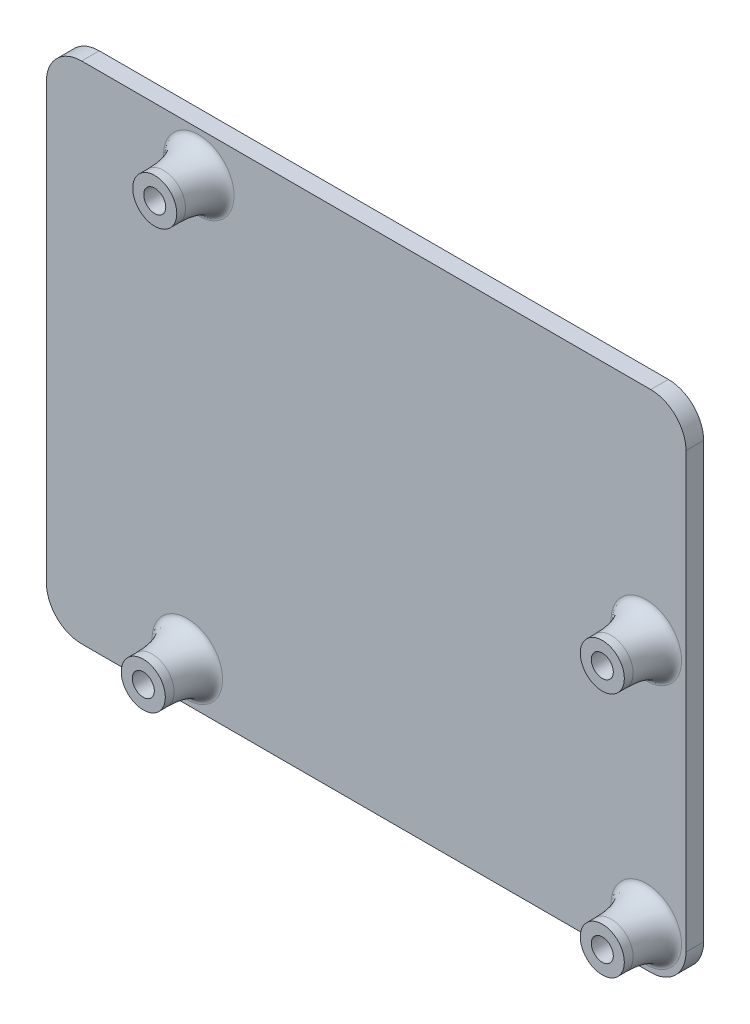
from build123d import *

# Parameters (mm, degrees)
SKETCH1_W           = 68.6
SKETCH1_H           = 53.3
BOSS_EXTRUDE1_DEPTH = 2
SKETCH6_W           = 72.6
SKETCH6_H           = 57.3
BOSS_EXTRUDE3_DEPTH = 2
SKETCH3_R           = 2.5
BOSS_EXTRUDE2_DEPTH = 5
FILLET1_SIZE        = 1.5
FILLET1_SIZE_2      = 4
FILLET2_R           = 4


with BuildPart() as part:
    # Sketch1 → Boss-Extrude1 (new body)
    with BuildSketch(Plane.XY):
        with Locations((16.907139599, -0.839393248)):
            Rectangle(SKETCH1_W, SKETCH1_H)
    extrude(amount=BOSS_EXTRUDE1_DEPTH)

    # Sketch6 → Boss-Extrude3 (add)
    with BuildSketch(Plane.XY.offset(2)):
        with Locations((16.907139599, -0.839393248)):
            Rectangle(SKETCH6_W, SKETCH6_H)
    extrude(amount=-BOSS_EXTRUDE3_DEPTH)

    # Sketch3 → Boss-Extrude2 (add)
    with BuildSketch(Plane.XY.offset(2)):
        with Locations((-2.092860401, 23.210606752)):
            Circle(SKETCH3_R)
    boss_extrude2 = extrude(amount=BOSS_EXTRUDE2_DEPTH)

    # Sketch5 → Tap Drill for M3x0.5 Tap1 (revolve, cut)
    with BuildSketch(Plane(origin=(-2.092860401, 23.210606752, 7), x_dir=(0, -1, 0), z_dir=(1, 0, 0))):
        Polygon((0, 0), (0, 10.751075774), (1.25, 10), (1.25, 0), align=None)
    tap_drill_for_m3x0_5_tap1 = revolve(axis=Axis((-2.092860401, 23.210606752, 13.35), (0, 0, -1)), mode=Mode.SUBTRACT)

    # Sketch-Pattern1: Boss-Extrude2, Tap Drill for M3x0.5 Tap1 at 3 more places
    with Locations((50.8, -48.2, 0), (-1.3, -48.2, 0), (50.8, -20.3, 0)):
        add(boss_extrude2)
        add(tap_drill_for_m3x0_5_tap1, mode=Mode.SUBTRACT)

    # Fillet1
    # an asymmetric fillet: 4, 1.5 mm, written as the material it adds along each edge
    with BuildSketch(Plane(origin=(-2.092860401, 23.210606752, 2), x_dir=(1, 0, 0), z_dir=(0, -1, 0))) as fillet1_piece_1:
        with BuildLine():
            Bezier((2.5 + FILLET1_SIZE, 0), (2.5, 0), (2.5, FILLET1_SIZE_2), weights=[1, 0.707106781, 1])
            Line((2.5, FILLET1_SIZE_2), (2.5, 0))
            Line((2.5, 0), (2.5 + FILLET1_SIZE, 0))
        make_face()
    revolve(axis=Axis((-2.092860401, 23.210606752, 2), (0, 0, 1)))
    with BuildSketch(Plane(origin=(48.707139599, -24.989393248, 2), x_dir=(1, 0, 0), z_dir=(0, -1, 0))) as fillet1_piece_2:
        with BuildLine():
            Bezier((2.5 + FILLET1_SIZE, 0), (2.5, 0), (2.5, FILLET1_SIZE_2), weights=[1, 0.707106781, 1])
            Line((2.5, FILLET1_SIZE_2), (2.5, 0))
            Line((2.5, 0), (2.5 + FILLET1_SIZE, 0))
        make_face()
    revolve(axis=Axis((48.707139599, -24.989393248, 2), (0, 0, 1)))
    with BuildSketch(Plane(origin=(-3.392860401, -24.989393248, 2), x_dir=(1, 0, 0), z_dir=(0, -1, 0))) as fillet1_piece_3:
        with BuildLine():
            Bezier((2.5 + FILLET1_SIZE, 0), (2.5, 0), (2.5, FILLET1_SIZE_2), weights=[1, 0.707106781, 1])
            Line((2.5, FILLET1_SIZE_2), (2.5, 0))
            Line((2.5, 0), (2.5 + FILLET1_SIZE, 0))
        make_face()
    revolve(axis=Axis((-3.392860401, -24.989393248, 2), (0, 0, 1)))
    with BuildSketch(Plane(origin=(48.707139599, 2.910606752, 2), x_dir=(1, 0, 0), z_dir=(0, -1, 0))) as fillet1_piece_4:
        with BuildLine():
            Bezier((2.5 + FILLET1_SIZE, 0), (2.5, 0), (2.5, FILLET1_SIZE_2), weights=[1, 0.707106781, 1])
            Line((2.5, FILLET1_SIZE_2), (2.5, 0))
            Line((2.5, 0), (2.5 + FILLET1_SIZE, 0))
        make_face()
    revolve(axis=Axis((48.707139599, 2.910606752, 2), (0, 0, 1)))

    # Fillet2
    fillet2_edges = [part.edges().sort_by_distance(p)[0] for p in [
        (-19.392860401, 27.810606752, 1),
        (53.207139599, 27.810606752, 1),
        (53.207139599, -29.489393248, 1),
        (-19.392860401, -29.489393248, 1),
    ]]
    fillet(fillet2_edges, radius=FILLET2_R)


solid = part.part
